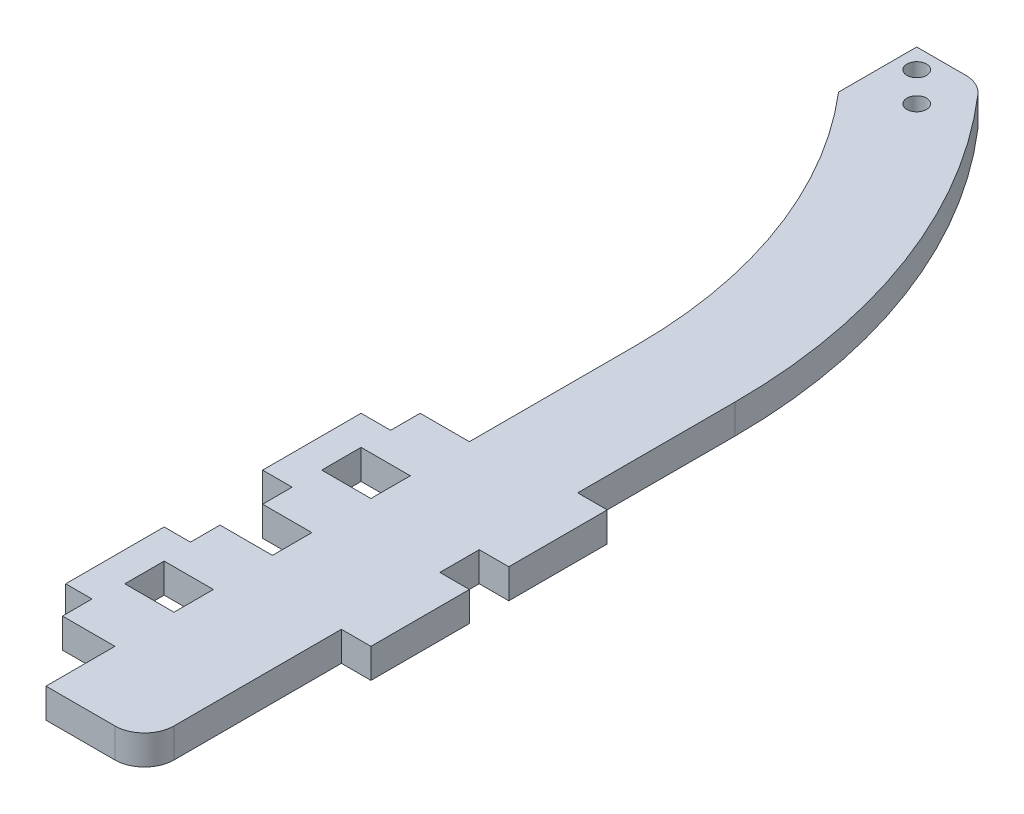
from build123d import *

# Parameters (mm, degrees)
SKETCH1_R              = 50
BOSS_EXTRUDE1_DEPTH    = 3
SPLIT1_SURFACE_1_BACK  = 170.732
SPLIT1_SURFACE_1_DEPTH = 341.464
SPLIT1_SURFACE_2_BACK  = 170.732
SPLIT1_SURFACE_2_DEPTH = 341.464
BODY_DELETE1_DEPTH     = 3
FILLET1_R              = 3
BOSS_EXTRUDE4_DEPTH    = 3
SPLIT2_SURFACE_3_BACK  = 109.724
SPLIT2_SURFACE_3_DEPTH = 219.448
SPLIT2_SURFACE_4_BACK  = 109.724
SPLIT2_SURFACE_4_DEPTH = 219.448
FILLET2_R              = 3
SKETCH5_R              = 1
CUT_EXTRUDE1_DEPTH     = 3
SKETCH6_W              = 3
SKETCH6_H              = 10
BOSS_EXTRUDE5_DEPTH    = 3
BOSS_EXTRUDE6_DEPTH    = 3
SKETCH8_W              = 5
SKETCH8_H              = 3
BOSS_EXTRUDE7_DEPTH    = 3
SKETCH9_W              = 5
SKETCH9_H              = 4
CUT_EXTRUDE2_DEPTH     = 3


# Read off the part's stored shape, not the designer's step: Body-Delete1
with BuildPart() as part:
    # Sketch1 → Boss-Extrude1 (new body)
    with BuildSketch(Plane(origin=(0, 0, 0), x_dir=(1, 0, 0), z_dir=(0, 1, 0))):
        with BuildLine():
            ThreePointArc((10, 0), (-107.445626465, 17.320508076), (0, -33.166247904))
            Line((0, -33.166247904), (0, -60))
            Line((0, -60), (10, -60))
            Line((10, -60), (10, 0))
        make_face()
        with Locations(Location((-50, 0, 0), (0, 0, 270))):
            Circle(SKETCH1_R, mode=Mode.SUBTRACT)
    extrude(amount=BOSS_EXTRUDE1_DEPTH)


with BuildPart() as body_2:
    # Split1: the piece behind the surface
    add(part.part)
    # Split1 surface: a surface, the sketch's curves swept straight by 341.464 mm
    with BuildLine(Plane(origin=(0, 3, 0), x_dir=(1, 0, 0), z_dir=(0, 1, 0)).offset(-SPLIT1_SURFACE_1_BACK), mode=Mode.PRIVATE) as split1_surface_1_path:
        Line((0, -33.166247904), (0, 0))
        Line((0, 0), (-12, 0))
        Line((-12, 0), (-12, 32.496153619))
        Line((-12, 32.496153619), (-12, 67.159700612))
        Line((-12, 67.159700612), (-127.638562935, 67.159700612))
        Line((-127.638562935, 67.159700612), (-127.638562935, -72.196904976))
        Line((-127.638562935, -72.196904976), (0, -72.196904976))
        Line((0, -72.196904976), (0, -33.166247904))
    split1_surface_1 = Shell.extrude(split1_surface_1_path.wire(), (0 * SPLIT1_SURFACE_1_DEPTH, 1 * SPLIT1_SURFACE_1_DEPTH, 0 * SPLIT1_SURFACE_1_DEPTH))
    split(bisect_by=split1_surface_1, keep=Keep.BOTTOM)

    # Fillet1
    fillet1_edges = [body_2.edges().sort_by_distance(p)[0] for p in [
        (10, 1.5, 60),
    ]]
    fillet(fillet1_edges, radius=FILLET1_R)

    # Sketch3 → Boss-Extrude4 (add)
    with BuildSketch(Plane(origin=(0, 3, 0), x_dir=(1, 0, 0), z_dir=(0, 1, 0))):
        Polygon((0, -50), (-8, -50), (-8, -40), (0, -40), (3, -40), (3, -50), align=None)
        Polygon((-8, -20), (-8, -30), (0, -30), (3, -30), (3, -20), (0, -20), align=None)
    extrude(amount=-BOSS_EXTRUDE4_DEPTH)


with BuildPart() as part_1:
    add(part.part)

    # Split1: split by a surface, the side it looks to stays
    # Split1 surface: a surface, the sketch's curves swept straight by 341.464 mm
    with BuildLine(Plane(origin=(0, 3, 0), x_dir=(1, 0, 0), z_dir=(0, 1, 0)).offset(-SPLIT1_SURFACE_2_BACK), mode=Mode.PRIVATE) as split1_surface_2_path:
        Line((0, -33.166247904), (0, 0))
        Line((0, 0), (-12, 0))
        Line((-12, 0), (-12, 32.496153619))
        Line((-12, 32.496153619), (-12, 67.159700612))
        Line((-12, 67.159700612), (-127.638562935, 67.159700612))
        Line((-127.638562935, 67.159700612), (-127.638562935, -72.196904976))
        Line((-127.638562935, -72.196904976), (0, -72.196904976))
        Line((0, -72.196904976), (0, -33.166247904))
    split1_surface_2 = Shell.extrude(split1_surface_2_path.wire(), (0 * SPLIT1_SURFACE_2_DEPTH, 1 * SPLIT1_SURFACE_2_DEPTH, 0 * SPLIT1_SURFACE_2_DEPTH))
    split(bisect_by=split1_surface_2, keep=Keep.TOP)

    # Body-Delete1 outline → Body-Delete1 (cut)
    with BuildSketch(Plane(origin=(0, 0, 0), x_dir=(1, 0, 0), z_dir=(0, 1, 0))):
        with BuildLine():
            ThreePointArc((-12, 46.432747065), (-109.329587897, -8.94427191), (0, -33.166247904))
            Line((0, -33.166247904), (0, 0))
            ThreePointArc((0, 0), (-96.904157598, -17.320508075), (-12, 32.496153619))
            Line((-12, 32.496153619), (-12, 46.432747065))
        make_face()
    extrude(amount=BODY_DELETE1_DEPTH, mode=Mode.SUBTRACT)


with BuildPart() as body_2_2:
    # Split2: the piece behind the surface
    add(body_2.part)
    # Split2 surface: a surface, the sketch's curves swept straight by 219.448 mm
    with BuildLine(Plane(origin=(0, 3, 0), x_dir=(1, 0, 0), z_dir=(0, 1, 0)).offset(-SPLIT2_SURFACE_3_BACK), mode=Mode.PRIVATE) as split2_surface_3_path:
        Line((-12, 40.432747065), (-5.669502994, 40.432747065))
        Line((-5.669502994, 40.432747065), (-5.042290504, 40.432747065))
        Line((-5.042290504, 40.432747065), (-5.042290504, 47.453598883))
        Line((-5.042290504, 47.453598883), (-14.646815791, 47.453598883))
        Line((-14.646815791, 47.453598883), (-14.646815791, 40.432747065))
        Line((-14.646815791, 40.432747065), (-12, 40.432747065))
    split2_surface_3 = Shell.extrude(split2_surface_3_path.wire(), (0 * SPLIT2_SURFACE_3_DEPTH, 1 * SPLIT2_SURFACE_3_DEPTH, 0 * SPLIT2_SURFACE_3_DEPTH))
    split(bisect_by=split2_surface_3, keep=Keep.BOTTOM)

    # Fillet2
    fillet2_edges = [body_2_2.edges().sort_by_distance(p)[0] for p in [
        (-5.669502994, 1.5, -40.432747065),
    ]]
    fillet(fillet2_edges, radius=FILLET2_R)

    # Sketch5 → Cut-Extrude1 (cut)
    with BuildSketch(Plane(origin=(0, 3, 0), x_dir=(1, 0, 0), z_dir=(0, 1, 0))):
        with Locations(Location((-10, 38.432747065, 0), (0, 0, 270))):
            Circle(SKETCH5_R)
        with Locations(Location((-7, 35.432747065, 0), (0, 0, 270))):
            Circle(SKETCH5_R)
    extrude(amount=-CUT_EXTRUDE1_DEPTH, mode=Mode.SUBTRACT)

    # Sketch6 → Boss-Extrude5 (add)
    with BuildSketch(Plane(origin=(0, 3, 0), x_dir=(1, 0, 0), z_dir=(0, 1, 0))):
        with Locations((11.5, -35)):
            Rectangle(SKETCH6_W, SKETCH6_H)
        with Locations((11.5, -21)):
            Rectangle(SKETCH6_W, SKETCH6_H)
    extrude(amount=-BOSS_EXTRUDE5_DEPTH)

    # Sketch7 → Boss-Extrude6 (add)
    with BuildSketch(Plane(origin=(0, 3, 0), x_dir=(1, 0, 0), z_dir=(0, 1, 0))):
        Polygon((-5.328723834, -40), (-5.328723834, -37), (0, -37), (1.654581998, -37), (1.654581998, -41.537905148), (-0.328723834, -41.537905148), (-5.328723834, -41.537905148), align=None)
        Polygon((-5.328723834, -50), (-5.328723834, -53), (0, -53), (1.654581998, -53), (1.654581998, -47.713051581), (-5.328723834, -47.713051581), align=None)
    extrude(amount=-BOSS_EXTRUDE6_DEPTH)

    # Sketch8 → Boss-Extrude7 (add)
    with BuildSketch(Plane(origin=(0, 3, 0), x_dir=(1, 0, 0), z_dir=(0, 1, 0))):
        with Locations((-2.5, -18.5)):
            Rectangle(SKETCH8_W, SKETCH8_H)
        with Locations((-2.5, -31.5)):
            Rectangle(SKETCH8_W, SKETCH8_H)
    extrude(amount=-BOSS_EXTRUDE7_DEPTH)

    # Sketch9 → Cut-Extrude2 (cut)
    with BuildSketch(Plane(origin=(0, 3, 0), x_dir=(1, 0, 0), z_dir=(0, 1, 0))):
        with Locations((-2.5, -25)):
            Rectangle(SKETCH9_W, SKETCH9_H)
        with Locations((-2.5, -45)):
            Rectangle(SKETCH9_W, SKETCH9_H)
    extrude(amount=-CUT_EXTRUDE2_DEPTH, mode=Mode.SUBTRACT)


with BuildPart() as body_2_1:
    add(body_2.part)

    # Split2: split by a surface, the side it looks to stays
    # Split2 surface: a surface, the sketch's curves swept straight by 219.448 mm
    with BuildLine(Plane(origin=(0, 3, 0), x_dir=(1, 0, 0), z_dir=(0, 1, 0)).offset(-SPLIT2_SURFACE_4_BACK), mode=Mode.PRIVATE) as split2_surface_4_path:
        Line((-12, 40.432747065), (-5.669502994, 40.432747065))
        Line((-5.669502994, 40.432747065), (-5.042290504, 40.432747065))
        Line((-5.042290504, 40.432747065), (-5.042290504, 47.453598883))
        Line((-5.042290504, 47.453598883), (-14.646815791, 47.453598883))
        Line((-14.646815791, 47.453598883), (-14.646815791, 40.432747065))
        Line((-14.646815791, 40.432747065), (-12, 40.432747065))
    split2_surface_4 = Shell.extrude(split2_surface_4_path.wire(), (0 * SPLIT2_SURFACE_4_DEPTH, 1 * SPLIT2_SURFACE_4_DEPTH, 0 * SPLIT2_SURFACE_4_DEPTH))
    split(bisect_by=split2_surface_4, keep=Keep.TOP)


solid = body_2_2.part
